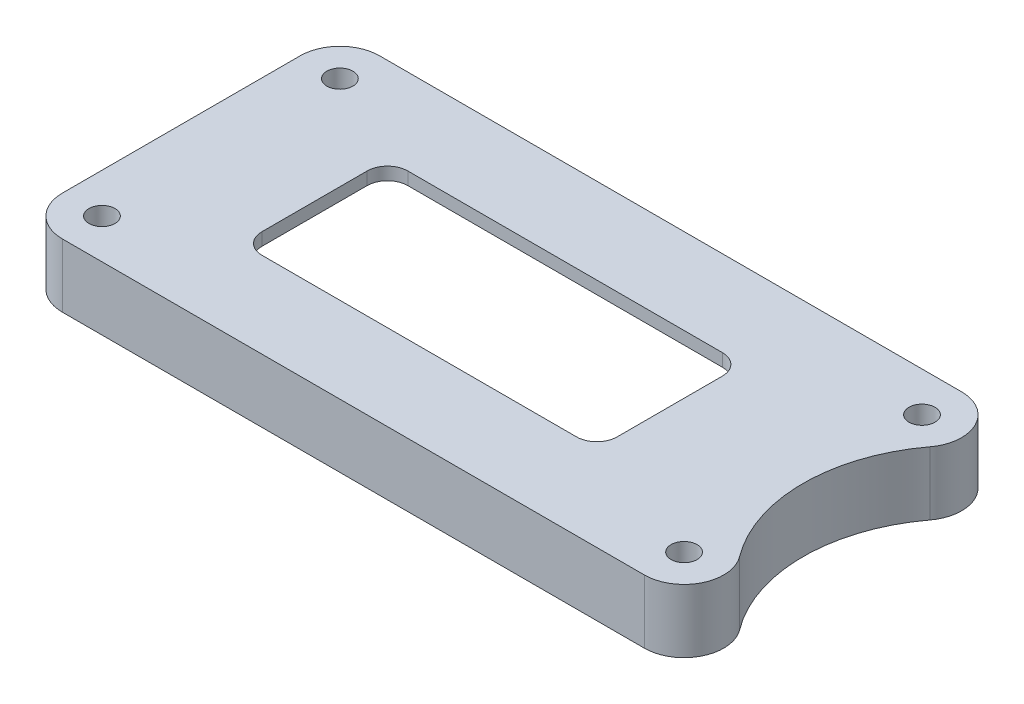
from build123d import *

# Parameters (mm, degrees)
BOSS_EXTRUDE1_DEPTH = 5
SKETCH2_W           = 28
SKETCH2_H           = 11.5
CUT_EXTRUDE1_DEPTH  = 27.220221204253797
SHELL1_T            = -1
FILLET1_R           = 1.6
FILLET2_R           = 3.125
BOSS_EXTRUDE2_DEPTH = 5
FILLET3_R           = 3.125
FILLET4_R           = 3.125
BOSS_EXTRUDE3_START = -5
BOSS_EXTRUDE3_DEPTH = 5
FILLET5_R           = 3.125
SKETCH7_R           = 1.0250000000000001
CUT_EXTRUDE2_DEPTH  = 31.730939361252858


with BuildPart() as part:
    # Sketch1 → Boss-Extrude1 (new body)
    with BuildSketch(Plane(origin=(0, 0, 0), x_dir=(1, 0, 0), z_dir=(0, 1, 0))):
        Polygon((-22.500000000000007, 12.500000000000004), (22.499999999999996, 12.500000000000004), (22.499999999999996, -12.499999999999996), (-22.500000000000004, -12.499999999999996), align=None)
    extrude(amount=BOSS_EXTRUDE1_DEPTH)

    # Sketch2 → Cut-Extrude1 (cut, through all)
    with BuildSketch(Plane(origin=(0, 5, 0), x_dir=(1, 0, 0), z_dir=(0, 1, 0))):
        Rectangle(SKETCH2_W, SKETCH2_H)
    extrude(amount=-CUT_EXTRUDE1_DEPTH, mode=Mode.SUBTRACT)

    # Shell1
    shell1_openings = [part.faces().sort_by_distance(p)[0] for p in [
        (14, 2.5, 0),
        (0, 2.5, 5.75),
        (-14, 2.5, 0),
        (0, 2.5, -5.75),
        (0, 0, -11.985218493),
    ]]
    offset(amount=SHELL1_T, openings=shell1_openings, kind=Kind.INTERSECTION)

    # Fillet1
    fillet1_edges = [part.edges().sort_by_distance(p)[0] for p in [
        (14.000000000000002, 4.5, -5.750000000000001),
        (14.000000000000002, 4.5, 5.749999999999999),
        (-13.999999999999998, 4.5, 5.749999999999999),
        (-13.999999999999998, 4.5, -5.750000000000001),
    ]]
    fillet(fillet1_edges, radius=FILLET1_R)

    # Fillet2
    fillet2_edges = [part.edges().sort_by_distance(p)[0] for p in [
        (21.499999999999996, 2, 11.499999999999996),
        (21.499999999999993, 2, -11.500000000000004),
        (-21.500000000000007, 2, -11.500000000000004),
        (-21.500000000000004, 2, 11.499999999999996),
    ]]
    fillet(fillet2_edges, radius=FILLET2_R)

    # Sketch4 → Boss-Extrude2 (add)
    with BuildSketch(Plane.XZ):
        with BuildLine():
            Line((22.499999999999996, 12.499999999999996), (22.499999999999996, -12.500000000000004))
            Line((22.499999999999996, -12.500000000000004), (37, -12.5))
            ThreePointArc((37, -12.500000000000002), (24.5, 6.814e-14), (37.000000000000135, 12.500000000000002))
            Line((37.000000000000135, 12.500000000000002), (22.499999999999996, 12.499999999999996))
        make_face()
    extrude(amount=-BOSS_EXTRUDE2_DEPTH)

    # Fillet3
    fillet3_edges = [part.edges().sort_by_distance(p)[0] for p in [
        (37, 2.5, -12.5),
    ]]
    fillet(fillet3_edges, radius=FILLET3_R)
    fillet3_2_edges = [part.edges().sort_by_distance(p)[0] for p in [
        (37.000000000000135, 2.5, 12.5),
    ]]
    fillet(fillet3_2_edges, radius=FILLET3_R)

    # Fillet4
    fillet4_edges = [part.edges().sort_by_distance(p)[0] for p in [
        (-22.500000000000004, 2.5, 12.499999999999996),
        (-22.500000000000007, 2.5, -12.500000000000004),
    ]]
    fillet(fillet4_edges, radius=FILLET4_R)

    # Sketch6 → Boss-Extrude3 (add)
    with BuildSketch(Plane.XZ.offset(BOSS_EXTRUDE3_START)):
        with BuildLine():
            ThreePointArc((-21.500000000000004, -8.375000000000004), (-20.584708691207968, -10.584708691207965), (-18.375000000000007, -11.500000000000004))
            Line((-18.375000000000004, -11.500000000000004), (-18.375000000000004, 11.499999999999996))
            ThreePointArc((-18.375000000000004, 11.499999999999996), (-20.58470869120796, 10.584708691207954), (-21.5, 8.374999999999996))
            Line((-21.5, 8.374999999999996), (-21.500000000000004, -8.375000000000004))
        make_face()
        Polygon((-24.5, -12.500000000000004), (-22.500000000000007, -12.500000000000004), (-22.500000000000007, -9.375000000000005), (-22.500000000000004, 9.374999999999996), (-22.500000000000004, 12.499999999999996), (-24.5, 12.499999999999991), align=None)
        with BuildLine():
            Line((-22.500000000000004, 9.374999999999996), (-22.500000000000007, -9.375000000000005))
            ThreePointArc((-22.500000000000007, -9.375000000000005), (-21.584708691207968, -11.584708691207966), (-19.375000000000007, -12.500000000000002))
            Line((-19.375000000000007, -12.500000000000004), (-18.375000000000004, -12.500000000000004))
            Line((-18.375000000000004, -12.500000000000004), (-18.375000000000004, -11.500000000000004))
            ThreePointArc((-18.375000000000007, -11.500000000000004), (-20.584708691207968, -10.584708691207965), (-21.500000000000004, -8.375000000000004))
            Line((-21.500000000000004, -8.375000000000004), (-21.5, 8.374999999999996))
            ThreePointArc((-21.5, 8.374999999999996), (-20.58470869120796, 10.584708691207954), (-18.375000000000004, 11.499999999999996))
            Line((-18.375000000000004, 11.499999999999996), (-18.375000000000004, 12.499999999999996))
            Line((-18.375000000000004, 12.499999999999996), (-19.375000000000004, 12.499999999999996))
            ThreePointArc((-19.375000000000004, 12.499999999999996), (-21.584708691207965, 11.584708691207958), (-22.500000000000004, 9.374999999999998))
        make_face()
        with BuildLine():
            Line((-22.500000000000007, -9.375000000000005), (-22.500000000000007, -12.500000000000004))
            Line((-22.500000000000007, -12.500000000000004), (-19.375000000000007, -12.500000000000004))
            ThreePointArc((-19.375000000000007, -12.500000000000002), (-21.584708691207968, -11.584708691207966), (-22.500000000000007, -9.375000000000005))
        make_face()
        with BuildLine():
            Line((-22.500000000000004, 12.499999999999996), (-22.500000000000004, 9.374999999999996))
            ThreePointArc((-22.500000000000004, 9.374999999999998), (-21.584708691207965, 11.584708691207958), (-19.375000000000004, 12.499999999999996))
            Line((-19.375000000000004, 12.499999999999996), (-22.500000000000004, 12.499999999999996))
        make_face()
    extrude(amount=BOSS_EXTRUDE3_DEPTH)

    # Fillet5
    fillet5_edges = [part.edges().sort_by_distance(p)[0] for p in [
        (-24.5, 2.5, 12.49999999999999),
        (-24.5, 2.5, -12.500000000000004),
        (-18.375000000000004, 2, 11.499999999999996),
        (-18.375000000000007, 2, -11.500000000000004),
    ]]
    fillet(fillet5_edges, radius=FILLET5_R)

    # Sketch7 → Cut-Extrude2 (cut, through all)
    with BuildSketch(Plane(origin=(0, 0, 0), x_dir=(-1, 0, 0), z_dir=(0, -1, 0))):
        with Locations(Location((-24.499999999999996, 9.375000000000005, 0), (0, 0, 90))):
            Circle(SKETCH7_R)
        with Locations(Location((-24.499999999999996, -9.375000000000005, 0), (0, 0, 90))):
            Circle(SKETCH7_R)
        with Locations(Location((21.375, -9.375000000000005, 0), (0, 0, 90))):
            Circle(SKETCH7_R)
        with Locations(Location((21.375, 9.375000000000005, 0), (0, 0, 90))):
            Circle(SKETCH7_R)
    extrude(amount=-CUT_EXTRUDE2_DEPTH, mode=Mode.SUBTRACT)


solid = part.part
